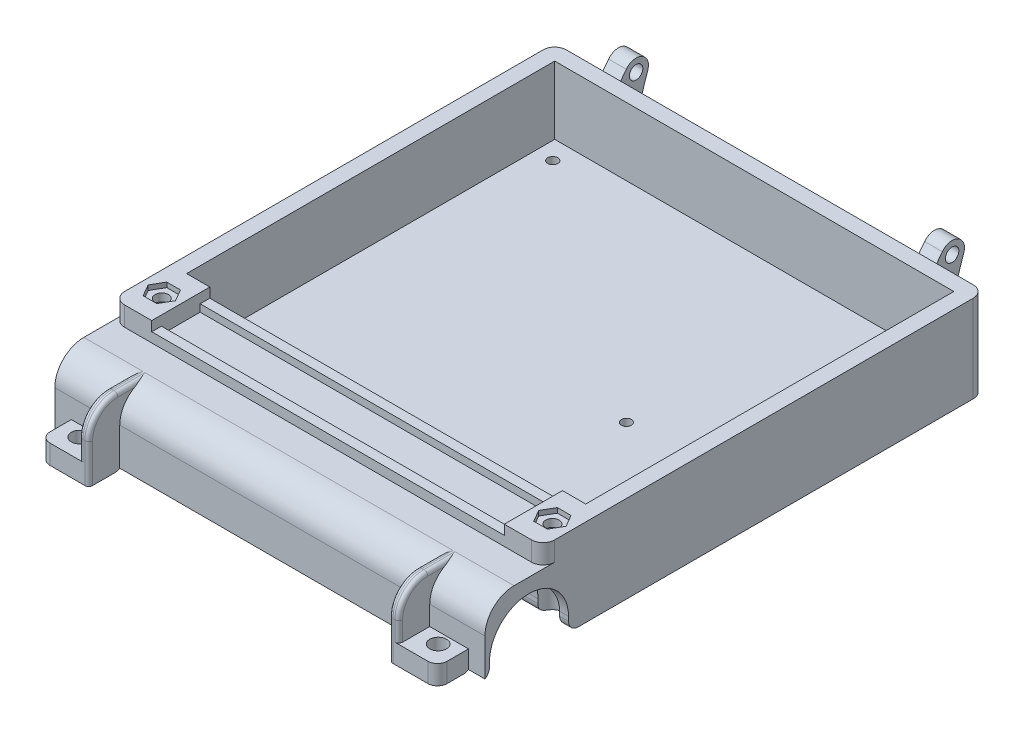
from build123d import *

# Parameters (mm, degrees)
SKETCH1_W           = 140.97
SKETCH1_H           = 144.78
SKETCH1_R           = 1.65
BOSS_EXTRUDE1_DEPTH = 6.35
SKETCH2_W           = 140.97
SKETCH2_H           = 144.78
SKETCH2_W_2         = 115.57
SKETCH2_H_2         = 12.7
SKETCH2_W_3         = 130.81
SKETCH2_H_3         = 120.65
BOSS_EXTRUDE2_DEPTH = 22.225
SKETCH3_W           = 115.57
SKETCH3_H           = 19.05
CUT_EXTRUDE1_DEPTH  = 3.175
SKETCH4_W           = 115.57
SKETCH4_H           = 12.7
BOSS_EXTRUDE3_DEPTH = 16.66875
SKETCH5_R           = 2.2
BOSS_EXTRUDE4_DEPTH = 2.9
SKETCH6_W           = 140.97
SKETCH6_H           = 22.225
BOSS_EXTRUDE5_DEPTH = 19.05
SKETCH7_W           = 12.7
SKETCH7_H           = 10.16
SKETCH7_R           = 2.75
BOSS_EXTRUDE6_DEPTH = 6.35
CUT_EXTRUDE2_DEPTH  = 183.829624059
SKETCH9_R           = 2.2
CUT_EXTRUDE3_DEPTH  = 136.184923161
CUT_EXTRUDE4_DEPTH  = 3.175
CUT_EXTRUDE5_DEPTH  = 1.5875
SKETCH12_R          = 3.75
CUT_EXTRUDE6_DEPTH  = 24.4475
SKETCH13_W          = 3.175
SKETCH13_H          = 10.16
BOSS_EXTRUDE7_DEPTH = 22.225
FILLET1_R           = 3.175
FILLET2_R           = 9.525
FILLET3_R           = 1.27
FILLET4_R           = 3.81


with BuildPart() as part:
    # Sketch1 → Boss-Extrude1 (new body)
    with BuildSketch(Plane(origin=(0, 0, 0), x_dir=(1, 0, 0), z_dir=(0, 1, 0))):
        with Locations((0, -10.16)):
            Rectangle(SKETCH1_W, SKETCH1_H)
        with Locations(Location((61.595, 50.8, 0), (0, 0, 270))):
            Circle(SKETCH1_R, mode=Mode.SUBTRACT)
        with Locations(Location((-59.69, 50.8, 0), (0, 0, 270))):
            Circle(SKETCH1_R, mode=Mode.SUBTRACT)
        with Locations(Location((26.67, -11.43, 0), (0, 0, 270))):
            Circle(SKETCH1_R, mode=Mode.SUBTRACT)
    extrude(amount=BOSS_EXTRUDE1_DEPTH)

    # Sketch2 → Boss-Extrude2 (add)
    with BuildSketch(Plane(origin=(0, 6.35, 0), x_dir=(1, 0, 0), z_dir=(0, 1, 0))):
        with Locations((0, -10.16)):
            Rectangle(SKETCH2_W, SKETCH2_H)
        with Locations((0, -73.025)):
            Rectangle(SKETCH2_W_2, SKETCH2_H_2, mode=Mode.SUBTRACT)
        with Locations((0, -3.175)):
            Rectangle(SKETCH2_W_3, SKETCH2_H_3, mode=Mode.SUBTRACT)
    extrude(amount=BOSS_EXTRUDE2_DEPTH)

    # Sketch3 → Cut-Extrude1 (cut)
    with BuildSketch(Plane(origin=(0, 28.575, 0), x_dir=(1, 0, 0), z_dir=(0, 1, 0))):
        with Locations((0, -73.025)):
            Rectangle(SKETCH3_W, SKETCH3_H)
    extrude(amount=-CUT_EXTRUDE1_DEPTH, mode=Mode.SUBTRACT)

    # Sketch4 → Boss-Extrude3 (add)
    with BuildSketch(Plane(origin=(0, 6.35, 0), x_dir=(1, 0, 0), z_dir=(0, 1, 0))):
        with Locations((0, -73.025)):
            Rectangle(SKETCH4_W, SKETCH4_H)
    extrude(amount=BOSS_EXTRUDE3_DEPTH)

    # Sketch5 → Boss-Extrude4 (add, symmetric)
    with BuildSketch(Plane(origin=(51.78552, 0, 0), x_dir=(0, 0, -1), z_dir=(1, 0, 0))):
        with BuildLine():
            Line((62.23, 28.575), (64.094776903, 31.023606495))
            ThreePointArc((64.094776903, 31.023606495), (69.187909794, 32.153657309), (71.151791438, 27.320419638))
            Line((71.151791438, 27.320419638), (62.23, 0))
            Line((62.23, 0), (62.23, 28.575))
        make_face()
        with Locations((67.31, 28.575)):
            Circle(SKETCH5_R, mode=Mode.SUBTRACT)
    boss_extrude4 = extrude(amount=BOSS_EXTRUDE4_DEPTH, both=True)

    # Mirror1: Boss-Extrude4 across plane
    add(boss_extrude4.mirror(Plane(origin=(0, 0, 0), x_dir=(0, 0, 1), z_dir=(1, 0, 0))))

    # Sketch6 → Boss-Extrude5 (add)
    with BuildSketch(Plane.XY.offset(82.55)):
        with Locations((0, 11.1125)):
            Rectangle(SKETCH6_W, SKETCH6_H)
    extrude(amount=BOSS_EXTRUDE5_DEPTH)

    # Sketch7 → Boss-Extrude6 (add)
    # profile 1 of 2: a face of its own
    with BuildSketch(Plane.XZ):
        with Locations((58.7375, 106.68)):
            Rectangle(SKETCH7_W, SKETCH7_H)
        with Locations(Location((58.7375, 105.2, 0), (0, 0, 270))):
            Circle(SKETCH7_R, mode=Mode.SUBTRACT)
    # profile 2 of 2: a face of its own
    with BuildSketch(Plane.XZ):
        with Locations((-58.7375, 106.68)):
            Rectangle(SKETCH7_W, SKETCH7_H)
        with Locations(Location((-58.7375, 105.2, 0), (0, 0, 90))):
            Circle(SKETCH7_R, mode=Mode.SUBTRACT)
    extrude(amount=-BOSS_EXTRUDE6_DEPTH)

    # Sketch8 → Cut-Extrude2 (cut, through all)
    with BuildSketch(Plane(origin=(70.485, 0, 0), x_dir=(0, 0, -1), z_dir=(1, 0, 0))):
        with BuildLine():
            Line((-100.12, 4.572), (-100.12, 0))
            Line((-100.12, 0), (-74.212, 0))
            Line((-74.212, 0), (-74.212, 4.572))
            ThreePointArc((-74.212, 4.572), (-87.166, 17.526), (-100.12, 4.572))
        make_face()
    extrude(amount=-CUT_EXTRUDE2_DEPTH, mode=Mode.SUBTRACT)

    # Sketch9 → Cut-Extrude3 (cut, through all)
    with BuildSketch(Plane(origin=(0, 28.575, 0), x_dir=(1, 0, 0), z_dir=(0, 1, 0))):
        with Locations(Location((64.008, -73.025, 0), (0, 0, 270))):
            Circle(SKETCH9_R)
        with Locations(Location((-64.008, -73.025, 0), (0, 0, 327.347298672))):
            Circle(SKETCH9_R)
    extrude(amount=-CUT_EXTRUDE3_DEPTH, mode=Mode.SUBTRACT)

    # Sketch10 → Cut-Extrude4 (cut)
    with BuildSketch(Plane.XZ):
        Polygon((29.801, 13.237683693), (26.67, 15.045367386), (23.539, 13.237683693), (23.539, 9.622316307), (26.67, 7.814632614), (29.801, 9.622316307), align=None)
        Polygon((61.595, -47.184632614), (58.464, -48.992316307), (58.464, -52.607683693), (61.595, -54.415367386), (64.726, -52.607683693), (64.726, -48.992316307), align=None)
        Polygon((-56.559, -48.992316307), (-59.69, -47.184632614), (-62.821, -48.992316307), (-62.821, -52.607683693), (-59.69, -54.415367386), (-56.559, -52.607683693), align=None)
    extrude(amount=-CUT_EXTRUDE4_DEPTH, mode=Mode.SUBTRACT)

    # Sketch11 → Cut-Extrude5 (cut)
    with BuildSketch(Plane(origin=(0, 28.575, 0), x_dir=(1, 0, 0), z_dir=(0, 1, 0))):
        Polygon((66.248696395, -69.144), (61.767303605, -69.144), (59.526607211, -73.025), (61.767303605, -76.906), (66.248696395, -76.906), (68.489392789, -73.025), align=None)
        Polygon((-61.767303605, -69.144), (-66.248696395, -69.144), (-68.489392789, -73.025), (-66.248696395, -76.906), (-61.767303605, -76.906), (-59.526607211, -73.025), align=None)
    extrude(amount=-CUT_EXTRUDE5_DEPTH, mode=Mode.SUBTRACT)

    # Sketch12 → Cut-Extrude6 (cut)
    with BuildSketch(Plane.XZ):
        with Locations(Location((-64.008, 73.025, 0), (0, 0, 18.453403036))):
            Circle(SKETCH12_R)
        with Locations(Location((64.008, 73.025, 0), (0, 0, 18.453403036))):
            Circle(SKETCH12_R)
    extrude(amount=-CUT_EXTRUDE6_DEPTH, mode=Mode.SUBTRACT)

    # Sketch13 → Boss-Extrude7 (add)
    with BuildSketch(Plane.XZ):
        with Locations((50.8, 106.68)):
            Rectangle(SKETCH13_W, SKETCH13_H)
        with Locations((-50.8, 106.68)):
            Rectangle(SKETCH13_W, SKETCH13_H)
    extrude(amount=-BOSS_EXTRUDE7_DEPTH)

    # Fillet1
    # the kernel refuses this fillet: 3.175 mm, written as the material it takes off along each edge
    with BuildSketch(Plane(origin=(65.0875, -7.9375, 111.76), x_dir=(-1, 0, 0), z_dir=(0, 1, 0))) as fillet1_piece_1:
        with BuildLine():
            CenterArc((FILLET1_R, -FILLET1_R), FILLET1_R, 90, 90)
            Line((0, -FILLET1_R), (0, 0))
            Line((0, 0), (FILLET1_R, 0))
        make_face()
    extrude(amount=22.225, mode=Mode.SUBTRACT)
    with BuildSketch(Plane(origin=(-65.0875, -7.9375, 111.76), x_dir=(1, 0, 0), z_dir=(0, 1, 0))) as fillet1_piece_2:
        with BuildLine():
            CenterArc((FILLET1_R, FILLET1_R), FILLET1_R, 180, 90)
            Line((0, FILLET1_R), (0, 0))
            Line((0, 0), (FILLET1_R, 0))
        make_face()
    extrude(amount=22.225, mode=Mode.SUBTRACT)
    with BuildSketch(Plane(origin=(-59.627680203, 0, 74.212), x_dir=(0, 1, 0), z_dir=(-1, 0, 0))) as fillet1_piece_3:
        with BuildLine():
            CenterArc((FILLET1_R, FILLET1_R), FILLET1_R, 180, 90)
            Line((0, FILLET1_R), (0, 0))
            Line((0, 0), (FILLET1_R, 0))
        make_face()
    extrude(amount=18.794819797, mode=Mode.SUBTRACT)
    with BuildSketch(Plane(origin=(78.4225, 0, 100.12), x_dir=(0, 1, 0), z_dir=(-1, 0, 0))) as fillet1_piece_4:
        with BuildLine():
            CenterArc((FILLET1_R, -FILLET1_R), FILLET1_R, 90, 90)
            Line((0, -FILLET1_R), (0, 0))
            Line((0, 0), (FILLET1_R, 0))
        make_face()
    extrude(amount=156.845, mode=Mode.SUBTRACT)
    with BuildSketch(Plane(origin=(78.4225, 0, 74.212), x_dir=(0, 1, 0), z_dir=(-1, 0, 0))) as fillet1_piece_5:
        with BuildLine():
            CenterArc((FILLET1_R, FILLET1_R), FILLET1_R, 180, 90)
            Line((0, FILLET1_R), (0, 0))
            Line((0, 0), (FILLET1_R, 0))
        make_face()
    extrude(amount=18.794819765, mode=Mode.SUBTRACT)
    with BuildSketch(Plane(origin=(68.388319797, 0, 74.212), x_dir=(0, 1, 0), z_dir=(-1, 0, 0))) as fillet1_piece_6:
        with BuildLine():
            CenterArc((FILLET1_R, FILLET1_R), FILLET1_R, 180, 90)
            Line((0, FILLET1_R), (0, 0))
            Line((0, 0), (FILLET1_R, 0))
        make_face()
    extrude(amount=136.776639561, mode=Mode.SUBTRACT)

    # Fillet2
    fillet2_edges = [part.edges().sort_by_distance(p)[0] for p in [
        (61.43625, 22.225, 101.6),
        (0, 22.225, 101.6),
        (50.8, 22.225, 111.76),
        (-61.43625, 22.225, 101.6),
        (-50.8, 22.225, 111.76),
    ]]
    fillet(fillet2_edges, radius=FILLET2_R)

    # Fillet3
    fillet3_edges = [part.edges().sort_by_distance(p)[0] for p in [
        (49.2125, 22.225, 97.155),
        (-52.3875, 22.225, 97.155),
        (-49.2125, 22.225, 97.155),
        (52.3875, 22.225, 97.155),
        (52.3875, 9.525, 111.76),
        (52.3875, 19.435192091, 108.970192091),
        (49.2125, 6.35, 111.76),
        (49.2125, 19.435192091, 108.970192091),
        (-49.2125, 6.35, 111.76),
        (-49.2125, 19.435192091, 108.970192091),
        (-52.3875, 9.525, 111.76),
        (-52.3875, 19.435192091, 108.970192091),
    ]]
    fillet(fillet3_edges, radius=FILLET3_R)

    # Fillet4
    fillet4_edges = [part.edges().sort_by_distance(p)[0] for p in [
        (-70.485, 14.2875, -62.23),
        (70.485, 14.2875, -62.23),
        (70.485, 25.4, 82.55),
        (-70.485, 25.4, 82.55),
    ]]
    fillet(fillet4_edges, radius=FILLET4_R)


solid = part.part
